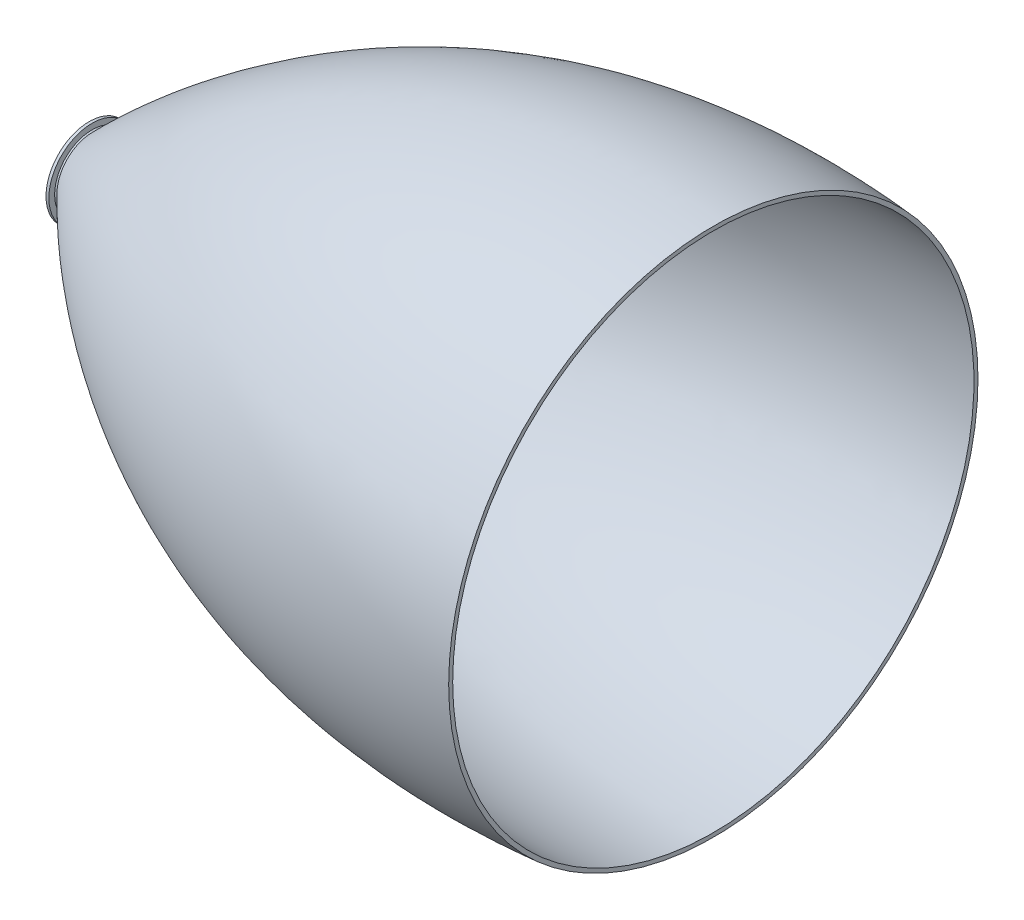
from build123d import *

# Parameters (mm, degrees)
SKETCH4_W           = 2299.140163329
SKETCH4_H           = 1084.867048291
CUT_EXTRUDE1_DEPTH  = 554.228
SKETCH5_R           = 95.504801646
SKETCH5_R_2         = 82.804801646
BOSS_EXTRUDE1_DEPTH = 6.35


with BuildPart() as part:
    # Sketch1 → Revolve3 (revolve)
    with BuildSketch(Plane.XY):
        with BuildLine():
            Line((1371.6, 575.99999989), (1371.6, 584.88999989))
            add(Edge.make_bspline(
                [(0, 78.994), (562.223862203, 652.376677868), (1371.6, 584.88999989)],
                knots=[0, 0, 0, 1, 1, 1], degree=2))
            add(Edge.make_bspline(
                [(0, 78.994), (-192.730394607, 176.706088879), (-412.824178468, 153.699870936)],
                knots=[0, 0, 0, 1, 1, 1], degree=2))
            Line((-412.824178468, 153.699870936), (-412.824178468, 144.809870936))
            add(Edge.make_bspline(
                [(0, 70.104), (-195.449728047, 157.410787998), (-412.824178468, 144.809870936)],
                knots=[0, 0, 0, 1, 1, 1], degree=2))
            add(Edge.make_bspline(
                [(0, 70.104), (587.141433478, 578.537228321), (1371.6, 575.99999989)],
                knots=[0, 0, 0, 1, 1, 1], degree=2))
        make_face()
    revolve(axis=Axis((-1229.828239288, 0, 0), (1, 0, 0)))

    # Sketch4 → Cut-Extrude1 (cut)
    with BuildSketch(Plane.ZY.offset(7.62)):
        with Locations((-63.658537287, 96.480710784)):
            Rectangle(SKETCH4_W, SKETCH4_H)
    extrude(amount=CUT_EXTRUDE1_DEPTH, mode=Mode.SUBTRACT)


with BuildPart() as body_2:
    # Sketch5 → Boss-Extrude1 (new body)
    with BuildSketch(Plane.ZY.offset(7.62)):
        Circle(SKETCH5_R)
        Circle(SKETCH5_R_2, mode=Mode.SUBTRACT)
    extrude(amount=-BOSS_EXTRUDE1_DEPTH)


solid = Compound([part.part, body_2.part])
